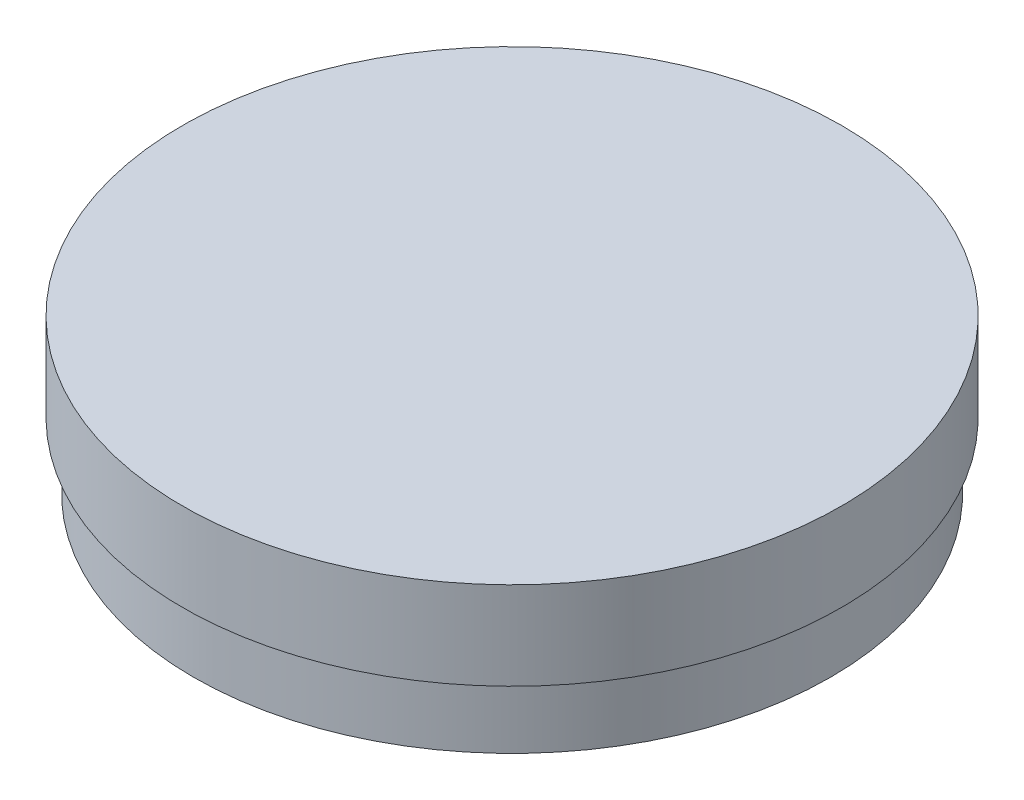
from build123d import *

# Parameters (mm, degrees)
SHELL1_OUTLINE_R = 79.375
SHELL1_DEPTH     = 31.75


# Read off the part's stored shape, not the designer's step: Shell1
with BuildPart() as part:
    # Sketch1 → Revolve1 (revolve)
    with BuildSketch(Plane.XY, mode=Mode.PRIVATE) as revolve1_sk:
        Polygon((0, 0), (92.075, 0), (92.075, 19.05), (95.25, 19.05), (95.25, 44.45), (0, 44.45), align=None)
    revolve(revolve1_sk.sketch.rotate(Axis((0, 0, 0), (0, 1, 0)), 90), axis=Axis((0, 0, 0), (0, 1, 0)))

    # Shell1 outline → Shell1 (cut)
    with BuildSketch(Plane(origin=(0, 0, 0), x_dir=(1, 0, 0), z_dir=(0, 1, 0))):
        Circle(SHELL1_OUTLINE_R)
    extrude(amount=SHELL1_DEPTH, mode=Mode.SUBTRACT)


solid = part.part
